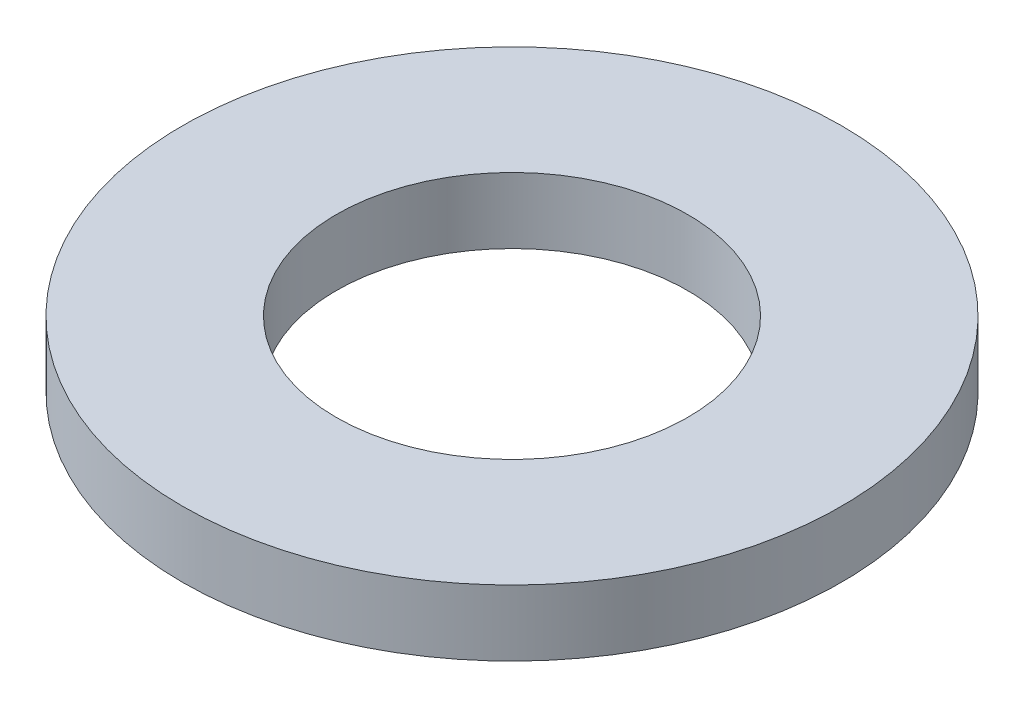
from build123d import *

# Parameters (mm, degrees)
SKETCH1_R           = 15
SKETCH1_R_2         = 8
BOSS_EXTRUDE1_DEPTH = 3


with BuildPart() as part:
    # Sketch1 → Boss-Extrude1 (new body)
    with BuildSketch(Plane(origin=(0, 0, 0), x_dir=(1, 0, 0), z_dir=(0, 1, 0))):
        Circle(SKETCH1_R)
        Circle(SKETCH1_R_2, mode=Mode.SUBTRACT)
    extrude(amount=BOSS_EXTRUDE1_DEPTH)


solid = part.part
